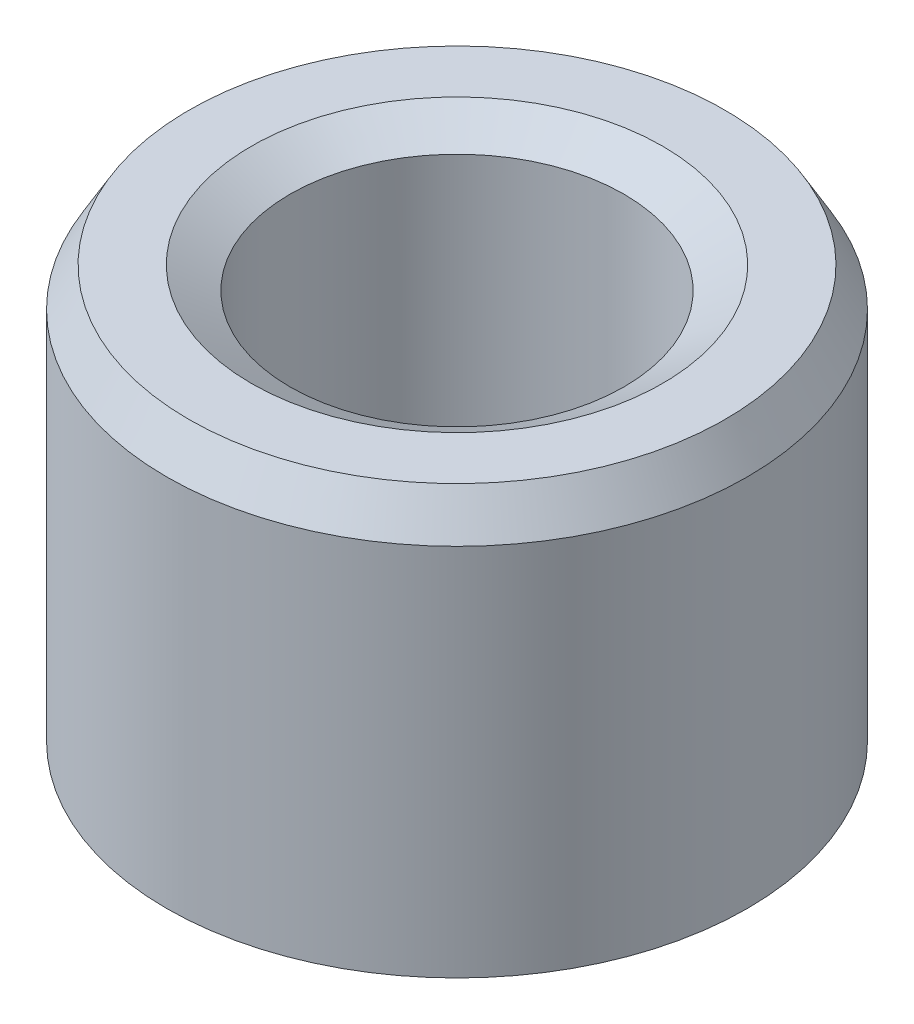
from build123d import *
from OCP.BRepFilletAPI import BRepFilletAPI_MakeChamfer

# Parameters (mm, degrees)
SKETCH1_R           = 17.5
BOSS_EXTRUDE1_DEPTH = 26.206319744
SKETCH2_R           = 10.067087322
CUT_EXTRUDE1_DEPTH  = 37.045404624
CHAMFER1_SIZE       = 2.326920211
CHAMFER1_SIZE2      = 1.34344801


with BuildPart() as part:
    # Sketch1 → Boss-Extrude1 (new body)
    with BuildSketch(Plane(origin=(0, 0, 0), x_dir=(1, 0, 0), z_dir=(0, 1, 0))):
        Circle(SKETCH1_R)
    extrude(amount=BOSS_EXTRUDE1_DEPTH)

    # Sketch2 → Cut-Extrude1 (cut, through all)
    with BuildSketch(Plane(origin=(0, 0, 0), x_dir=(1, 0, 0), z_dir=(0, 1, 0))):
        Circle(SKETCH2_R)
    extrude(amount=CUT_EXTRUDE1_DEPTH, mode=Mode.SUBTRACT)

    # Chamfer1: one chamfer whose edges measure the first distance from different faces: ONE call of the kernel's chamfer builder (chamfer() names one face for all edges)
    chamfer1_edges_1 = [part.edges().sort_by_distance(p)[0] for p in [
        (-10.067087322, 26.206319744, 0),
    ]]
    chamfer1_side_1 = [part.faces().sort_by_distance(p)[0] for p in [
        (-17.005025253, 26.206319744, 0),
    ]]
    chamfer1_edges_2 = [part.edges().sort_by_distance(p)[0] for p in [
        (-10.067087322, 0, 0),
    ]]
    chamfer1_side_2 = [part.faces().sort_by_distance(p)[0] for p in [
        (-10.067087322, 13.103159872, 0),
    ]]
    chamfer1_edges_3 = [part.edges().sort_by_distance(p)[0] for p in [
        (-17.5, 0, 0),
    ]]
    chamfer1_side_3 = [part.faces().sort_by_distance(p)[0] for p in [
        (-17.005025253, 0, 0),
    ]]
    chamfer1_edges_4 = [part.edges().sort_by_distance(p)[0] for p in [
        (-17.5, 26.206319744, 0),
    ]]
    chamfer1_side_4 = [part.faces().sort_by_distance(p)[0] for p in [
        (-17.5, 13.103159872, 0),
    ]]
    chamfer1 = BRepFilletAPI_MakeChamfer(part.part.solid().wrapped)
    for e in chamfer1_edges_1:
        chamfer1.Add(CHAMFER1_SIZE, CHAMFER1_SIZE2, e.wrapped, chamfer1_side_1[0].wrapped)  # the first distance lies on this face
    for e in chamfer1_edges_2:
        chamfer1.Add(CHAMFER1_SIZE, CHAMFER1_SIZE2, e.wrapped, chamfer1_side_2[0].wrapped)  # the first distance lies on this face
    for e in chamfer1_edges_3:
        chamfer1.Add(CHAMFER1_SIZE, CHAMFER1_SIZE2, e.wrapped, chamfer1_side_3[0].wrapped)  # the first distance lies on this face
    for e in chamfer1_edges_4:
        chamfer1.Add(CHAMFER1_SIZE, CHAMFER1_SIZE2, e.wrapped, chamfer1_side_4[0].wrapped)  # the first distance lies on this face
    add(Compound.cast(chamfer1.Shape()), mode=Mode.REPLACE)


solid = part.part
